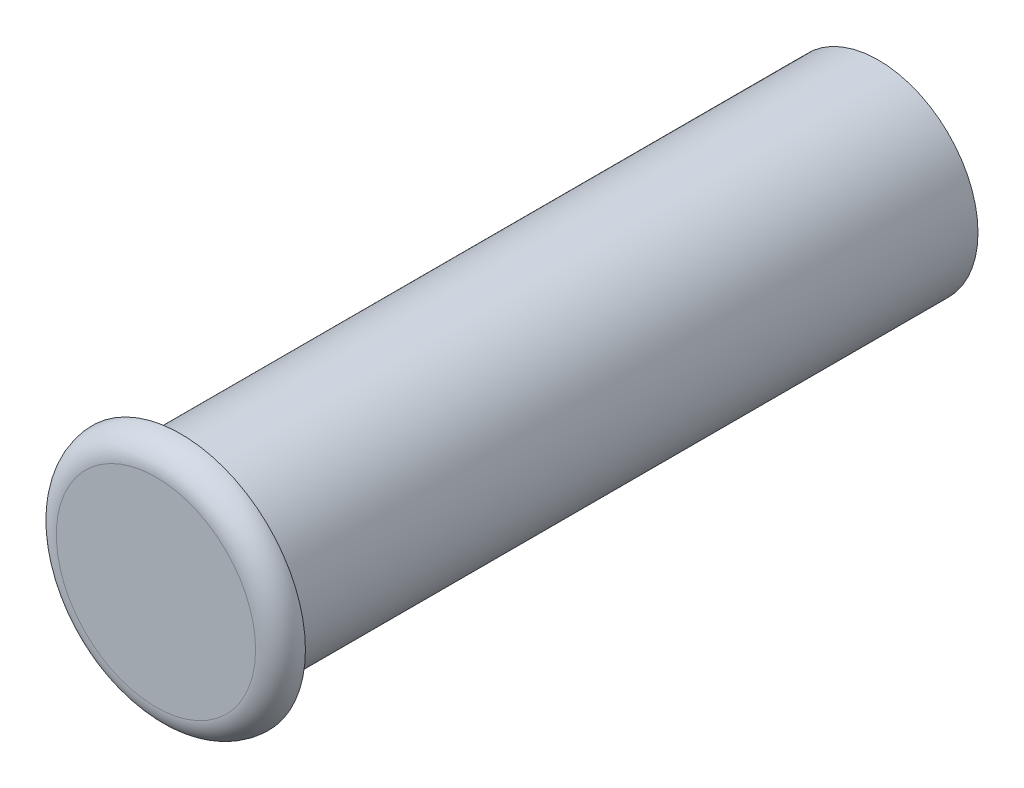
from build123d import *

# Parameters (mm, degrees)
SKETCH_1_R          = 2
EXTRUDE_1_DEPTH     = 7
SKETCH_2_R          = 2.5
EXTRUDE_2_DEPTH     = 0.5
FILLET_1_R          = 0.5
SKETCH_3_R          = 1.5
CUT_EXTRUDE_1_DEPTH = 14


with BuildPart() as part:
    # 草图1 → 凸台-拉伸1 (new, symmetric)
    with BuildSketch(Plane.XY):
        Circle(SKETCH_1_R)
    extrude(amount=EXTRUDE_1_DEPTH, both=True)

    # 草图2 → 凸台-拉伸2 (add)
    with BuildSketch(Plane.XY.offset(7)):
        Circle(SKETCH_2_R)
    extrude(amount=EXTRUDE_2_DEPTH)

    # 圆角1
    fillet_1_edges = [part.edges().sort_by_distance(p)[0] for p in [
        (-2.5, 0, 7.5),
    ]]
    fillet(fillet_1_edges, radius=FILLET_1_R - 0.0001)  # a hair under: the kernel refuses the full size

    # 草图3 → 切除-拉伸1 (cut)
    with BuildSketch(Plane(origin=(0, 0, -7), x_dir=(-1, 0, 0), z_dir=(0, 0, -1))):
        Circle(SKETCH_3_R)
    extrude(amount=-CUT_EXTRUDE_1_DEPTH, mode=Mode.SUBTRACT)


solid = part.part
